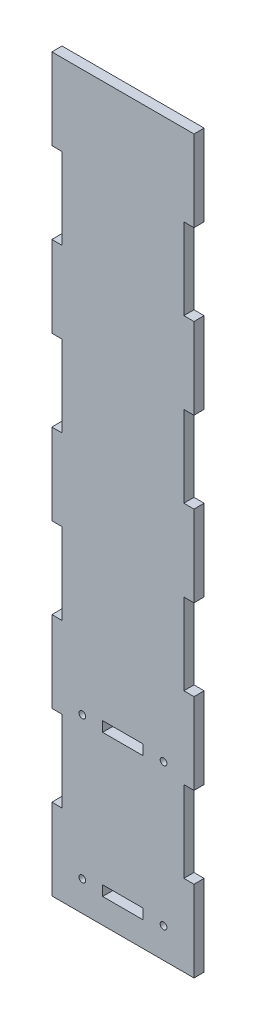
from build123d import *

# Parameters (mm, degrees)
SKETCH2_W           = 6.35
SKETCH2_H           = 88.9
BOSS_EXTRUDE1_DEPTH = 457.2
SKETCH4_W           = 6.35
SKETCH4_H           = 50.8
CUT_EXTRUDE1_DEPTH  = 460.399570091
SKETCH5_W           = 25.4
SKETCH5_H           = 6.35
CUT_EXTRUDE2_DEPTH  = 460.399570091
SKETCH6_R           = 2.0955
CUT_EXTRUDE3_DEPTH  = 460.399570091


with BuildPart() as part:
    # Sketch2 → Boss-Extrude1 (new body)
    with BuildSketch(Plane.ZX):
        with Locations((41.275, 0)):
            Rectangle(SKETCH2_W, SKETCH2_H)
    extrude(amount=BOSS_EXTRUDE1_DEPTH)

    # Sketch4 → Cut-Extrude1 (cut, through all)
    with BuildSketch(Plane.XY.offset(44.45)):
        with Locations((41.275, 381)):
            Rectangle(SKETCH4_W, SKETCH4_H)
        with Locations((41.275, 279.4)):
            Rectangle(SKETCH4_W, SKETCH4_H)
        with Locations((41.275, 177.8)):
            Rectangle(SKETCH4_W, SKETCH4_H)
        with Locations((41.275, 76.2)):
            Rectangle(SKETCH4_W, SKETCH4_H)
    cut_extrude1 = extrude(amount=-CUT_EXTRUDE1_DEPTH, mode=Mode.SUBTRACT)

    # Mirror1: Cut-Extrude1 across plane
    add(cut_extrude1.mirror(Plane(origin=(0, 0, 0), x_dir=(0, 0, 1), z_dir=(1, 0, 0))), mode=Mode.SUBTRACT)

    # Sketch5 → Cut-Extrude2 (cut, through all)
    with BuildSketch(Plane(origin=(0, 0, 38.1), x_dir=(-1, 0, 0), z_dir=(0, 0, -1))):
        with Locations((0, 107.6625)):
            Rectangle(SKETCH5_W, SKETCH5_H)
        with Locations((0, 18.7625)):
            Rectangle(SKETCH5_W, SKETCH5_H)
    extrude(amount=-CUT_EXTRUDE2_DEPTH, mode=Mode.SUBTRACT)

    # Sketch6 → Cut-Extrude3 (cut, through all)
    with BuildSketch(Plane.XY.offset(44.45)):
        with Locations((25.4, 107.6625)):
            Circle(SKETCH6_R)
        with Locations((-25.4, 107.6625)):
            Circle(SKETCH6_R)
        with Locations((-25.4, 18.7625)):
            Circle(SKETCH6_R)
        with Locations((25.4, 18.7625)):
            Circle(SKETCH6_R)
    extrude(amount=-CUT_EXTRUDE3_DEPTH, mode=Mode.SUBTRACT)


solid = part.part
